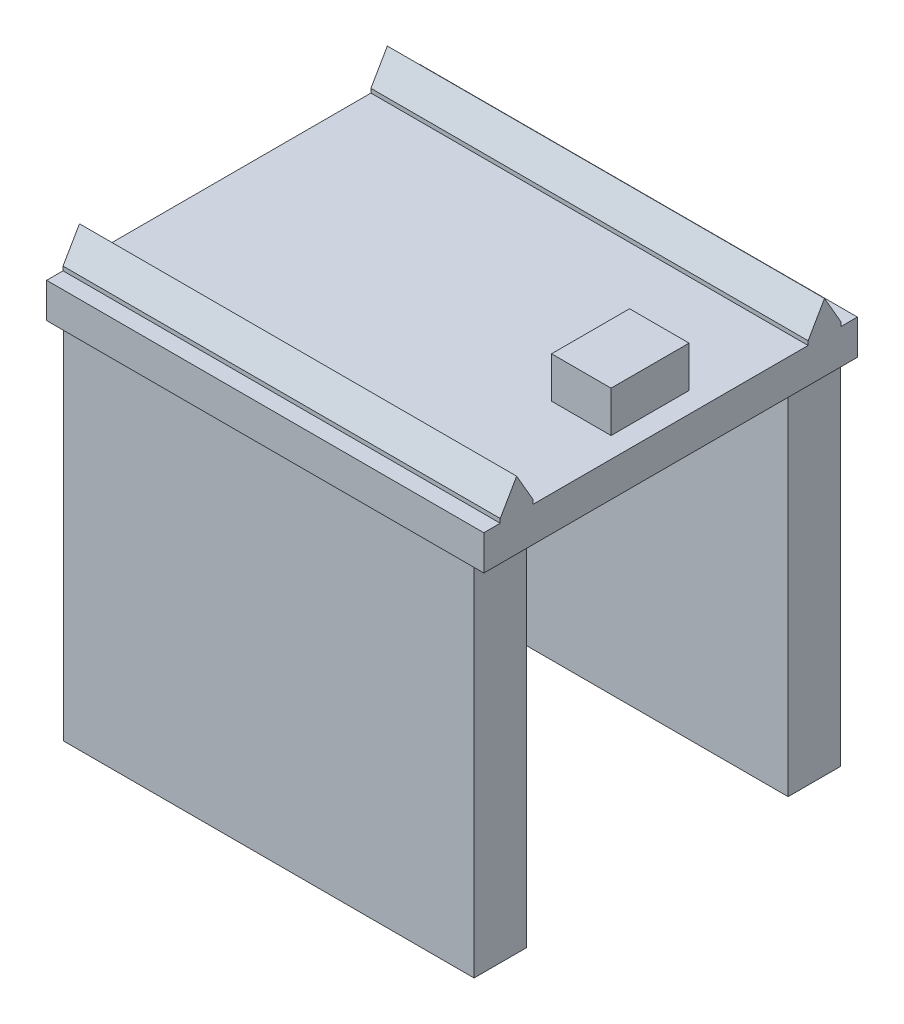
from build123d import *

# Parameters (mm, degrees)
SKETCH_2_W       = 21.3
SKETCH_2_H       = 18.2
EXTRUDE_1_DEPTH  = 1.7
SKETCH_4_W       = 21.3
SKETCH_4_H       = 1.6
EXTRUDE_2_DEPTH  = 1.6
CHAMFER_1_SIZE   = 1.4
CHAMFER_1_SIZE_2 = 0.808290377
SKETCH_5_W       = 2.9
SKETCH_5_H       = 3.8
EXTRUDE_3_DEPTH  = 2
SKETCH_6_W       = 20
SKETCH_6_H       = 2.55
EXTRUDE_4_DEPTH  = 17.5


with BuildPart() as part:
    # 草图2 → 凸台-拉伸1 (new body)
    with BuildSketch(Plane(origin=(0, 0, 0), x_dir=(1, 0, 0), z_dir=(0, 1, 0))):
        Rectangle(SKETCH_2_W, SKETCH_2_H)
    extrude(amount=EXTRUDE_1_DEPTH)

    # 草图4 → 凸台-拉伸2 (add)
    with BuildSketch(Plane(origin=(0, 1.7, 0), x_dir=(1, 0, 0), z_dir=(0, 1, 0))):
        with Locations((0, 7.5)):
            Rectangle(SKETCH_4_W, SKETCH_4_H)
        with Locations((0, -7.5)):
            Rectangle(SKETCH_4_W, SKETCH_4_H)
    extrude(amount=EXTRUDE_2_DEPTH)

    # 倒角1
    # the kernel refuses this chamfer: 1.4, 0.808290377 mm, written as the material it takes off along each edge
    with BuildSketch(Plane(origin=(14.271920057, 3.3, 8.3), x_dir=(0, -0.9998132206222079, 0.019326765612701028), z_dir=(-1, 0, 0)), Plane(origin=(-14.271920057, 3.3, 6.7), x_dir=(0, -0.9998132206222079, -0.019326765612701028), z_dir=(1, 0, 0)), Plane(origin=(14.271920057, 3.3, -6.7), x_dir=(0, -0.9998132206222079, 0.019326765612701028), z_dir=(-1, 0, 0)), Plane(origin=(-14.271920057, 3.3, -8.3), x_dir=(0, -0.9998132206222079, -0.019326765612701028), z_dir=(1, 0, 0))) as chamfer_1_piece_1:
        Polygon((CHAMFER_1_SIZE * 0.999813220622, -CHAMFER_1_SIZE * 0.0193267656127), (-CHAMFER_1_SIZE_2 * 0.0193267656095, -CHAMFER_1_SIZE_2 * 0.999813220456), (0, 0), align=None)
    extrude(amount=28.543840113, mode=Mode.SUBTRACT)

    # 草图5 → 凸台-拉伸3 (add)
    with BuildSketch(Plane(origin=(0, 1.7, 0), x_dir=(1, 0, 0), z_dir=(0, 1, 0))):
        with Locations((8.2, 0)):
            Rectangle(SKETCH_5_W, SKETCH_5_H)
    extrude(amount=EXTRUDE_3_DEPTH)

    # 草图6 → 凸台-拉伸4 (add)
    with BuildSketch(Plane.XZ):
        with Locations((0, -7.65)):
            Rectangle(SKETCH_6_W, SKETCH_6_H)
        with Locations((0, 7.65)):
            Rectangle(SKETCH_6_W, SKETCH_6_H)
    extrude(amount=EXTRUDE_4_DEPTH)


solid = part.part
